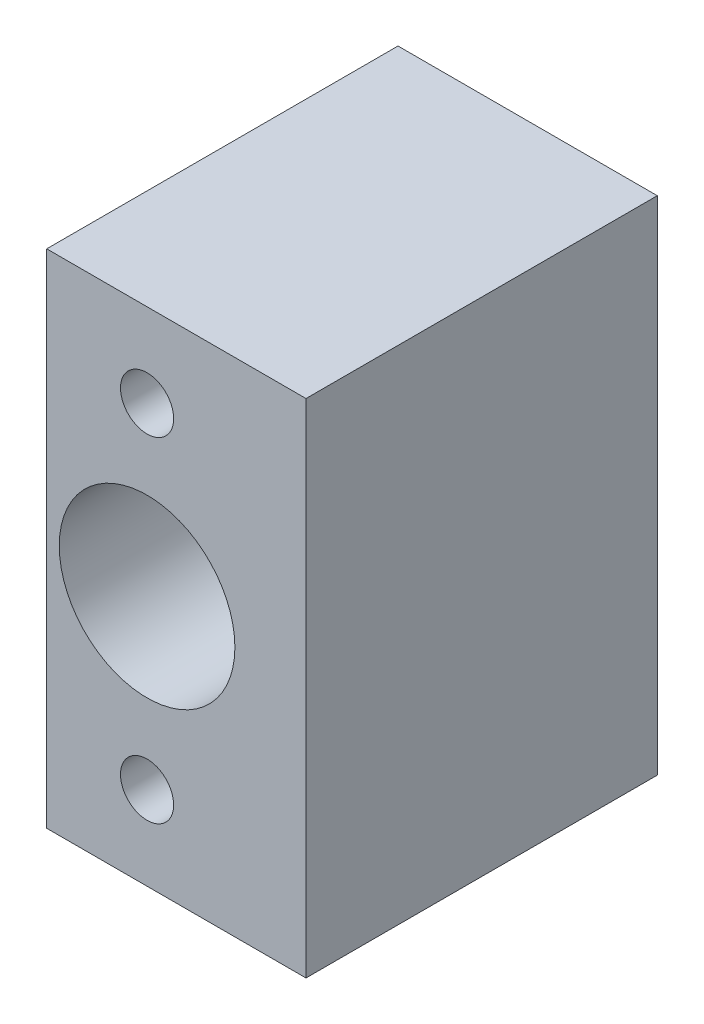
from build123d import *

# Parameters (mm, degrees)
SKETCH1_W               = 19
SKETCH1_H               = 30
BOSS_EXTRUDE1_DEPTH     = 18
SKETCH2_R               = 5.25
CUT_EXTRUDE1_DEPTH      = 11.5
SKETCH4_R               = 4.8
CUT_EXTRUDE3_DEPTH      = 1
CUT_EXTRUDE4_DEPTH      = 22.714050751
CUT_EXTRUDE4_DEPTH_BACK = 5
SKETCH5_R               = 2.36
CUT_EXTRUDE6_DEPTH      = 26.28339376
CUT_EXTRUDE6_DEPTH_BACK = 26.28339376
SKETCH11_W              = 15.5
SKETCH11_H              = 30
BOSS_EXTRUDE5_DEPTH     = 5
SKETCH12_R              = 4
CUT_EXTRUDE8_DEPTH      = 5
SKETCH13_R              = 1.5875
CUT_EXTRUDE9_DEPTH      = 30.055980452
SKETCH14_R              = 3
CUT_EXTRUDE10_DEPTH     = 1
SKETCH15_W              = 15.5
SKETCH15_H              = 2
CUT_EXTRUDE11_DEPTH     = 41


with BuildPart() as part:
    # Sketch1 → Boss-Extrude1 (new body)
    with BuildSketch(Plane.XY):
        Rectangle(SKETCH1_W, SKETCH1_H)
    extrude(amount=BOSS_EXTRUDE1_DEPTH)

    # Sketch2 → Cut-Extrude1 (cut)
    with BuildSketch(Plane.XY.offset(18)):
        Circle(SKETCH2_R)
    extrude(amount=-CUT_EXTRUDE1_DEPTH, mode=Mode.SUBTRACT)

    # Sketch4 → Cut-Extrude3 (cut)
    with BuildSketch(Plane.XY.offset(6.5)):
        Circle(SKETCH4_R)
    extrude(amount=-CUT_EXTRUDE3_DEPTH, mode=Mode.SUBTRACT)

    # Sketch5 → Cut-Extrude4 (cut, two sides: drawn at the far end of the back side and taken through both)
    with BuildSketch(Plane.XY.offset(5.5).offset(-CUT_EXTRUDE4_DEPTH_BACK)):
        Circle(SKETCH5_R)
    extrude(amount=CUT_EXTRUDE4_DEPTH + CUT_EXTRUDE4_DEPTH_BACK, mode=Mode.SUBTRACT)

    # Sketch6 → Cut-Extrude6 (cut, two sides: drawn at the far end of the back side and taken through both)
    with BuildSketch(Plane.XY.offset(-CUT_EXTRUDE6_DEPTH_BACK)):
        Polygon((-6, 92.53517602), (-6, 15), (-6, -15), (-6, -92.53517602), (-161.070352039, -92.53517602), (-161.070352039, 92.53517602), align=None)
    extrude(amount=CUT_EXTRUDE6_DEPTH + CUT_EXTRUDE6_DEPTH_BACK, mode=Mode.SUBTRACT)

    # Sketch11 → Boss-Extrude5 (add)
    with BuildSketch(Plane(origin=(0, 0, 0), x_dir=(-1, 0, 0), z_dir=(0, 0, -1))):
        with Locations((-1.75, 0)):
            Rectangle(SKETCH11_W, SKETCH11_H)
    extrude(amount=BOSS_EXTRUDE5_DEPTH)

    # Sketch12 → Cut-Extrude8 (cut)
    with BuildSketch(Plane(origin=(0, 0, -5), x_dir=(-1, 0, 0), z_dir=(0, 0, -1))):
        Circle(SKETCH12_R)
    extrude(amount=-CUT_EXTRUDE8_DEPTH, mode=Mode.SUBTRACT)

    # Sketch13 → Cut-Extrude9 (cut, through all)
    with BuildSketch(Plane(origin=(0, 0, -5), x_dir=(-1, 0, 0), z_dir=(0, 0, -1))):
        with Locations((0, -10)):
            Circle(SKETCH13_R)
        with Locations((0, 10)):
            Circle(SKETCH13_R)
    extrude(amount=-CUT_EXTRUDE9_DEPTH, mode=Mode.SUBTRACT)

    # Sketch14 → Cut-Extrude10 (cut)
    with BuildSketch(Plane.XY.offset(5.5)):
        Circle(SKETCH14_R)
    extrude(amount=-CUT_EXTRUDE10_DEPTH, mode=Mode.SUBTRACT)

    # Sketch15 → Cut-Extrude11 (cut)
    with BuildSketch(Plane.XZ.offset(15)):
        with Locations((1.75, 17)):
            Rectangle(SKETCH15_W, SKETCH15_H)
    extrude(amount=-CUT_EXTRUDE11_DEPTH, mode=Mode.SUBTRACT)


solid = part.part
